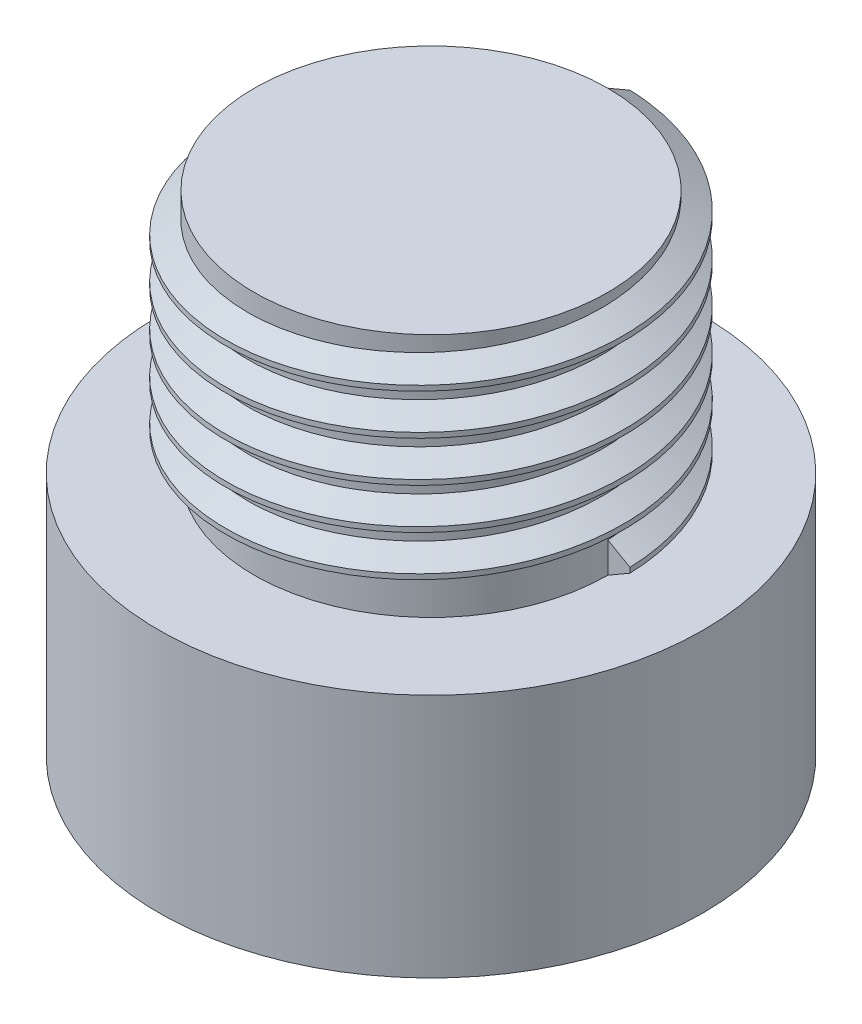
from build123d import *

# Parameters (mm, degrees)
THREAD_2_PITCH = 1.5


with BuildPart() as part:
    # Sketch 2 → Повернуть1 (revolve)
    with BuildSketch(Plane.XY):
        Polygon((-1.322875657, -3.5), (-5.291764647, 0), (0, 0), (0, 14.5), (-6.5, 14.5), (-6.5, 5.5), (-10, 5.5), (-10, -3.5), align=None)
        with BuildLine():
            Line((0, 0), (0, -4))
            ThreePointArc((0, -4), (-2, -2), (0, 0))
        make_face()
    revolve(axis=Axis((0, 0, 0), (0, -1, 0)))

    # Резьба2: the profile of Sketch 2 2 profile screwed along a right-hand helix of 5.25 turns, 8 arcs to a turn; built about Z, then put on its axis
    thread_2_z = Axis((0, 0, 0), (0, 0, 1))
    thread_2_corners = [(6.4997, 0, -0.000173205), (7.311898812, 0, 0.468749998), (7.311898812, 0, 0.656249998), (6.4997, 0, 1.125173201)]
    with BuildLine(mode=Mode.PRIVATE) as thread_2_profile:
        Line(thread_2_corners[0], thread_2_corners[1])
        Line(thread_2_corners[1], thread_2_corners[2])
        Line(thread_2_corners[2], thread_2_corners[3])
        Line(thread_2_corners[3], thread_2_corners[0])
    thread_2_cap = Face(thread_2_profile.wire())
    thread_2_turn_angles = [0, 22.5, 45, 67.5, 90, 112.5, 135, 157.5, 180, 202.5, 225, 247.5, 270, 292.5, 315, 337.5, 360]
    thread_2_turn_weights = [1, 0.9238795325112867, 1, 0.9238795325112867, 1, 0.9238795325112867, 1, 0.9238795325112867, 1, 0.9238795325112867, 1, 0.9238795325112867, 1, 0.9238795325112867, 1, 0.9238795325112867, 1]
    thread_2_turn_rails = [Edge.make_bspline([Vector(p[0], p[1], 0).rotate(thread_2_z, thread_2_turn_angles[k]) / thread_2_turn_weights[k] + Vector(0, 0, p[2] + THREAD_2_PITCH * thread_2_turn_angles[k] / 360) for k in range(17)], [0, 0, 0, 1, 1, 2, 2, 3, 3, 4, 4, 5, 5, 6, 6, 7, 7, 8, 8, 8], 2, thread_2_turn_weights) for p in thread_2_corners]
    thread_2_turn_sides = [Face.make_surface_from_curves(thread_2_turn_rails[p[0]], thread_2_turn_rails[p[1]]) for p in [(0, 1), (1, 2), (2, 3), (3, 0)]]
    thread_2_last_angles = [1800, 1822.5, 1845, 1867.5, 1890]
    thread_2_last_weights = [1, 0.9238795325112867, 1, 0.9238795325112867, 1]
    thread_2_last_rails = [Edge.make_bspline([Vector(p[0], p[1], 0).rotate(thread_2_z, thread_2_last_angles[k]) / thread_2_last_weights[k] + Vector(0, 0, p[2] + THREAD_2_PITCH * thread_2_last_angles[k] / 360) for k in range(5)], [0, 0, 0, 1, 1, 2, 2, 2], 2, thread_2_last_weights) for p in thread_2_corners]
    thread_2_last_sides = [Face.make_surface_from_curves(thread_2_last_rails[p[0]], thread_2_last_rails[p[1]]) for p in [(0, 1), (1, 2), (2, 3), (3, 0)]]
    thread_2 = Plane(origin=(0, 5.5, 0), x_dir=(1, 0, 0), z_dir=(0, 1, 0)) * Solid(Shell([*[p.moved(Location((0, 0, THREAD_2_PITCH * i))) for i in range(5) for p in thread_2_turn_sides], *thread_2_last_sides, thread_2_cap, thread_2_cap.rotate(thread_2_z, 1890).moved(Location((0, 0, THREAD_2_PITCH * 1890 / 360)))]))
    add(thread_2)


solid = part.part
